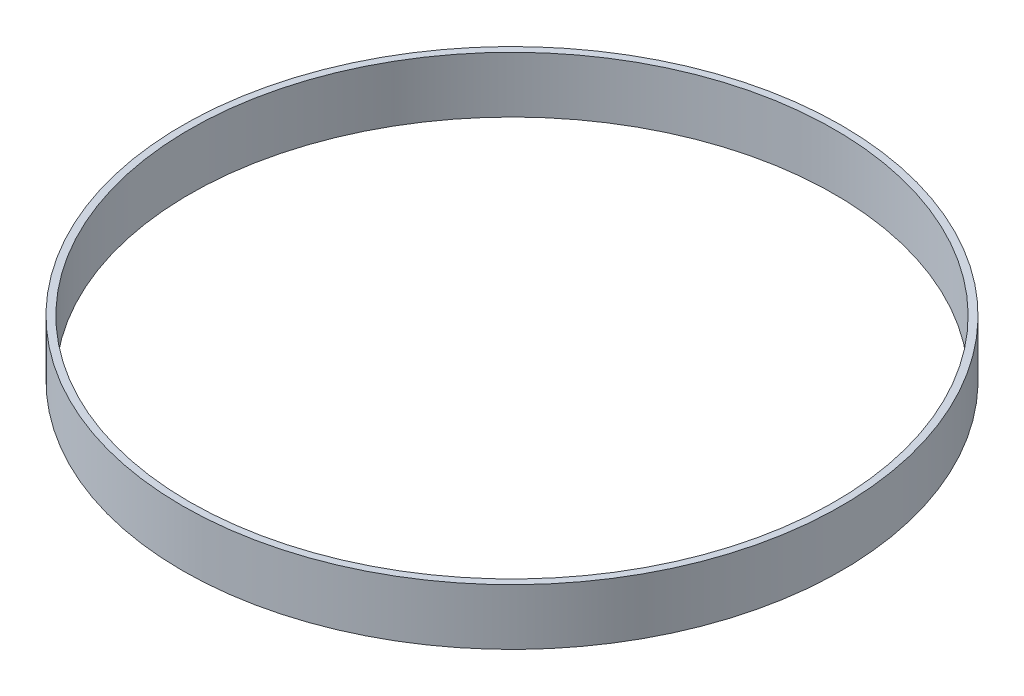
from build123d import *

# Parameters (mm, degrees)
ESQUISSE1_R        = 47
ESQUISSE1_R_2      = 46
BOSS_EXTRU_1_DEPTH = 8


with BuildPart() as part:
    # Esquisse1 → Boss.-Extru.1 (new body)
    with BuildSketch(Plane(origin=(0, 0, 0), x_dir=(1, 0, 0), z_dir=(0, 1, 0))):
        Circle(ESQUISSE1_R)
        Circle(ESQUISSE1_R_2, mode=Mode.SUBTRACT)
    extrude(amount=BOSS_EXTRU_1_DEPTH)


solid = part.part
